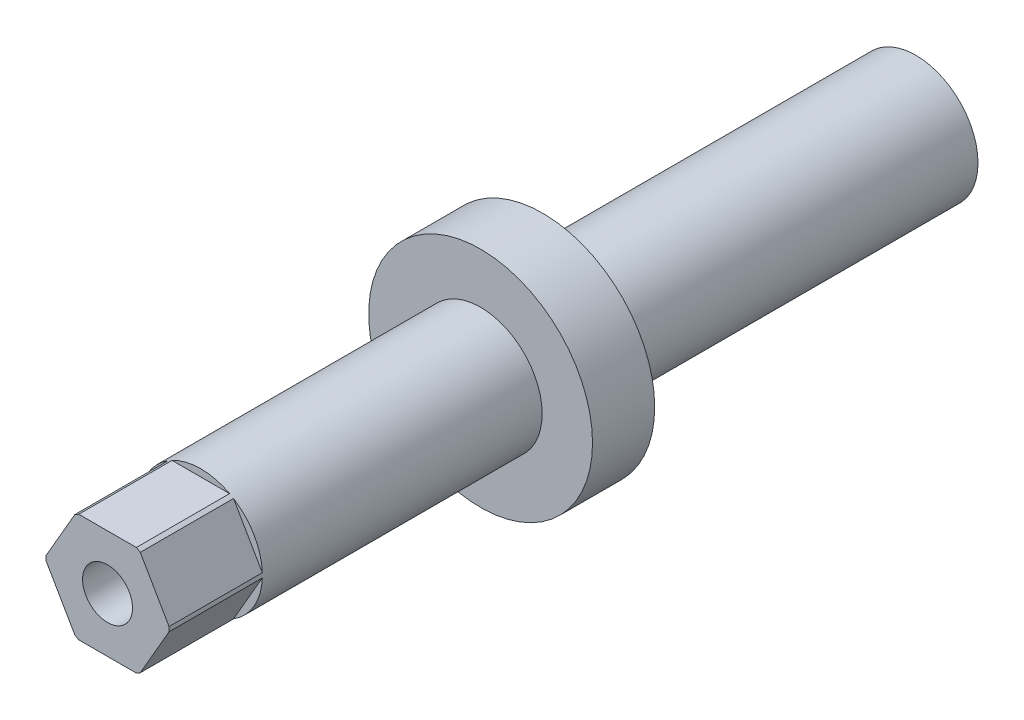
from build123d import *

# Parameters (mm, degrees)
F_1_4_20_TAPPED_HOLE1_D = 5.1054
CUT_EXTRUDE1_DEPTH      = 9.525


with BuildPart() as part:
    # Sketch1 → Revolve2 (revolve)
    with BuildSketch(Plane(origin=(0, 0, 0), x_dir=(0, 0, -1), z_dir=(1, 0, 0))):
        Polygon((38.1, 6.2865), (0, 6.2865), (0, 0), (82.55, 0), (82.55, 6.35), (44.45, 6.35), (44.45, 11.43), (38.1, 11.43), align=None)
    revolve(axis=Axis((0, 0, 0), (0, 0, -1)))

    # 1/4-20 Tapped Hole1 (through all)
    with Locations(Plane(origin=(0, 0, -82.55), x_dir=(-1, 0, 0), z_dir=(0, 0, -1))):
        with Locations((0, 0)):
            Hole(F_1_4_20_TAPPED_HOLE1_D / 2)

    # Sketch4 → Cut-Extrude1 (cut)
    with BuildSketch(Plane.XY):
        with BuildLine():
            Line((-3.34146525, -5.324912416), (-6.28224205, -0.231337584))
            ThreePointArc((-6.28224205, -0.231337584), (-5.444268701, -3.14325), (-3.34146525, -5.324912416))
        make_face()
        with BuildLine():
            ThreePointArc((-3.34146525, 5.324912416), (-5.444268701, 3.14325), (-6.28224205, 0.231337584))
            Line((-6.28224205, 0.231337584), (-3.34146525, 5.324912416))
        make_face()
        with BuildLine():
            Line((2.9407768, -5.55625), (-2.9407768, -5.55625))
            ThreePointArc((-2.9407768, -5.55625), (0, -6.2865), (2.9407768, -5.55625))
        make_face()
        with BuildLine():
            ThreePointArc((2.9407768, 5.55625), (0, 6.2865), (-2.9407768, 5.55625))
            Line((-2.9407768, 5.55625), (2.9407768, 5.55625))
        make_face()
        with BuildLine():
            Line((6.28224205, -0.231337584), (3.34146525, -5.324912416))
            ThreePointArc((3.34146525, -5.324912416), (5.444268701, -3.14325), (6.28224205, -0.231337584))
        make_face()
        with BuildLine():
            ThreePointArc((6.28224205, 0.231337584), (5.444268701, 3.14325), (3.34146525, 5.324912416))
            Line((3.34146525, 5.324912416), (6.28224205, 0.231337584))
        make_face()
    extrude(amount=-CUT_EXTRUDE1_DEPTH, mode=Mode.SUBTRACT)


solid = part.part
